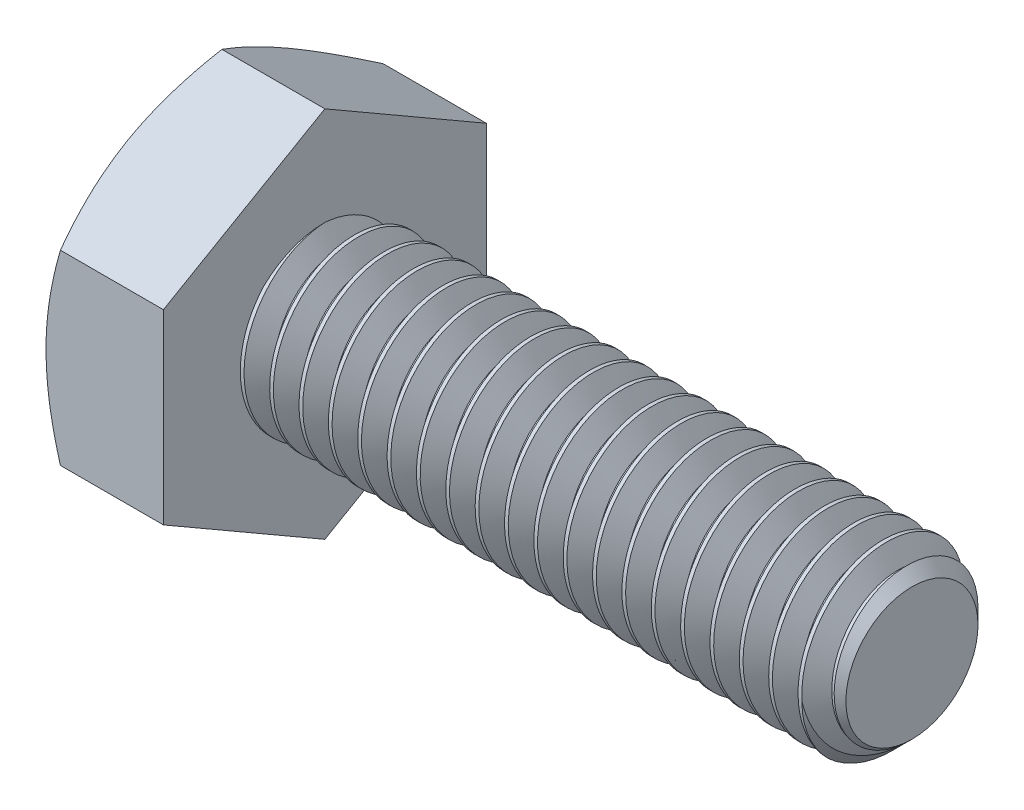
from build123d import *

# Parameters (mm, degrees)
SKETCH2_R           = 1.5
BOSS_EXTRUDE1_DEPTH = 10
CHAMFER1_SIZE       = 0.375
CUT_SWEEP1_PITCH    = 0.5
BOSS_EXTRUDE2_DEPTH = 2
SKETCH6_OUTSIDE_W   = 57.936
SKETCH6_OUTSIDE_H   = 58.786
SKETCH6_OUTSIDE_R   = 2.75
CUT_EXTRUDE1_DEPTH  = 13.714001609
CUT_EXTRUDE1_DRAFT  = -60
SKETCH7_W           = 0.13170865
SKETCH7_H           = 0.131708651
CUT_EXTRUDE2_DEPTH  = 0.25


with BuildPart() as part:
    # Sketch2 → Boss-Extrude1 (new body)
    with BuildSketch(Plane(origin=(6, 0, 0), x_dir=(0, 0, -1), z_dir=(1, 0, 0))):
        Circle(SKETCH2_R)
    extrude(amount=-BOSS_EXTRUDE1_DEPTH)

    # Chamfer1
    chamfer1_edges = [part.edges().sort_by_distance(p)[0] for p in [
        (6, 0, 1.5),
    ]]
    chamfer(chamfer1_edges, length=CHAMFER1_SIZE)

    # Cut-Sweep1: the profile of Sketch5 profile screwed along a right-hand helix of 21 turns, 6 arcs to a turn; built about Z, then put on its axis
    cut_sweep1_z = Axis((0, 0, 0), (0, 0, 1))
    cut_sweep1_corners = [(1.5003, 0, 0.000173205), (1.175240474, 0, -0.1875), (1.175240474, 0, -0.25), (1.5003, 0, -0.437673205)]
    with BuildLine(mode=Mode.PRIVATE) as cut_sweep1_profile:
        Line(cut_sweep1_corners[0], cut_sweep1_corners[1])
        Line(cut_sweep1_corners[1], cut_sweep1_corners[2])
        Line(cut_sweep1_corners[2], cut_sweep1_corners[3])
        Line(cut_sweep1_corners[3], cut_sweep1_corners[0])
    cut_sweep1_cap = Face(cut_sweep1_profile.wire())
    cut_sweep1_turn_angles = [0, 30, 60, 90, 120, 150, 180, 210, 240, 270, 300, 330, 360]
    cut_sweep1_turn_weights = [1, 0.8660254037844387, 1, 0.8660254037844387, 1, 0.8660254037844387, 1, 0.8660254037844387, 1, 0.8660254037844387, 1, 0.8660254037844387, 1]
    cut_sweep1_turn_rails = [Edge.make_bspline([Vector(p[0], p[1], 0).rotate(cut_sweep1_z, cut_sweep1_turn_angles[k]) / cut_sweep1_turn_weights[k] + Vector(0, 0, p[2] + CUT_SWEEP1_PITCH * cut_sweep1_turn_angles[k] / 360) for k in range(13)], [0, 0, 0, 1, 1, 2, 2, 3, 3, 4, 4, 5, 5, 6, 6, 6], 2, cut_sweep1_turn_weights) for p in cut_sweep1_corners]
    cut_sweep1_turn_sides = [Face.make_surface_from_curves(cut_sweep1_turn_rails[p[0]], cut_sweep1_turn_rails[p[1]]) for p in [(0, 1), (1, 2), (2, 3), (3, 0)]]
    cut_sweep1 = Plane(origin=(6, 0, 0), x_dir=(0, 1, 0), z_dir=(-1, 0, 0)) * Solid(Shell([*[p.moved(Location((0, 0, CUT_SWEEP1_PITCH * i))) for i in range(21) for p in cut_sweep1_turn_sides], cut_sweep1_cap, cut_sweep1_cap.rotate(cut_sweep1_z, 7560).moved(Location((0, 0, CUT_SWEEP1_PITCH * 7560 / 360)))]))
    add(cut_sweep1, mode=Mode.SUBTRACT)

    # Sketch3 → Boss-Extrude2 (add)
    with BuildSketch(Plane.ZY.offset(4)):
        Polygon((-2.75, -1.58771324), (0, -3.175426481), (2.75, -1.58771324), (2.75, 1.58771324), (0, 3.175426481), (-2.75, 1.58771324), align=None)
    extrude(amount=BOSS_EXTRUDE2_DEPTH)


with BuildPart() as cut_extrude1_tool:
    # Sketch6 outside → Cut-Extrude1 (with draft: the straight prism first)
    with BuildSketch(Plane.ZY.offset(6)):
        Rectangle(SKETCH6_OUTSIDE_W, SKETCH6_OUTSIDE_H)
        Circle(SKETCH6_OUTSIDE_R, mode=Mode.SUBTRACT)
    extrude(amount=-CUT_EXTRUDE1_DEPTH)
    # Cut-Extrude1: the draft: its side faces are tilted about the plane it starts from
    cut_extrude1_sides = [cut_extrude1_tool.faces().sort_by_distance(p)[0] for p in [
        (0.857000805, -29.393, 0),
        (0.857000805, 0, 28.968),
        (0.857000805, 29.393, 0),
        (0.857000805, 0, -28.968),
        (0.857000805, 0, -2.75),
    ]]
    draft(cut_extrude1_sides, Plane.ZY.offset(6), CUT_EXTRUDE1_DRAFT)


with BuildPart() as part_1:
    add(part.part)

    # Cut-Extrude1: cut by cut_extrude1_tool
    add(cut_extrude1_tool.part, mode=Mode.SUBTRACT)

    # Sketch7 → Cut-Extrude2 (cut)
    # profile 1 of 3: a face of its own
    with BuildSketch(Plane.ZY.offset(6)):
        with BuildLine():
            add(Edge.make_bspline(
                [(-0.726867115, 1.93846607), (-0.73936394, 1.943354899), (-0.763324498, 1.952728405), (-0.795641113, 1.971487429), (-0.822991963, 1.993067216), (-0.845041214, 2.017988147), (-0.861846751, 2.04573504), (-0.873947403, 2.075954123), (-0.881034967, 2.108813748), (-0.881967772, 2.131535333), (-0.882447958, 2.143231863)],
                knots=[0, 0, 0, 0, 1.16287356, 2.229614231, 3.228817875, 4.173350329, 5.100165549, 6.029633206, 6.985702163, 8, 8, 8, 8], degree=3))
            add(Edge.make_bspline(
                [(-0.882447958, 2.143231863), (-0.882221957, 2.152231827), (-0.88177831, 2.169899038), (-0.877945096, 2.195822679), (-0.871805651, 2.220664012), (-0.863092343, 2.244352926), (-0.852175996, 2.267084402), (-0.838401407, 2.28844199), (-0.822568373, 2.309029297), (-0.804020725, 2.328014123), (-0.783581538, 2.345402385), (-0.761442709, 2.360876232), (-0.737434831, 2.373530076), (-0.711958184, 2.384109756), (-0.684886798, 2.392392527), (-0.656125314, 2.398033555), (-0.625775122, 2.401621668), (-0.604978449, 2.402088541), (-0.594335285, 2.402327474)],
                knots=[0, 0, 0, 0, 0.994101948, 1.951453197, 2.889123786, 3.817215529, 4.736003873, 5.669743943, 6.620499649, 7.601567446, 8.596478358, 9.582687259, 10.579761808, 11.589151689, 12.62747492, 13.702346593, 14.8241243, 16, 16, 16, 16], degree=3))
            add(Edge.make_bspline(
                [(-0.594335285, 2.402327474), (-0.583624302, 2.402086115), (-0.562760515, 2.401615976), (-0.532249079, 2.398076073), (-0.503306091, 2.392142977), (-0.475948592, 2.383725406), (-0.450133452, 2.372963035), (-0.426030302, 2.359734669), (-0.403391015, 2.344258484), (-0.382794243, 2.326349923), (-0.364053636, 2.306907049), (-0.34781667, 2.286077151), (-0.333890741, 2.264346279), (-0.322383053, 2.241582413), (-0.313869622, 2.217526335), (-0.307380476, 2.192631271), (-0.303616471, 2.16660142), (-0.30316161, 2.148937457), (-0.302929896, 2.139939147)],
                knots=[0, 0, 0, 0, 1.171211919, 2.281388661, 3.353996503, 4.398126828, 5.406889753, 6.407389155, 7.400009931, 8.40008733, 9.387021643, 10.349004252, 11.283445052, 12.206096336, 13.131640667, 14.068727932, 15.016178647, 16, 16, 16, 16], degree=3))
            add(Edge.make_bspline(
                [(-0.302929896, 2.139939147), (-0.303306308, 2.128645746), (-0.30404438, 2.106501511), (-0.311565668, 2.074580412), (-0.323288238, 2.044780466), (-0.340230889, 2.017669609), (-0.361688126, 1.992967845), (-0.388314847, 1.971494332), (-0.419706675, 1.952764625), (-0.443062266, 1.943360555), (-0.455218023, 1.93846607)],
                knots=[0, 0, 0, 0, 0.998680737, 1.958225066, 2.887911823, 3.823713378, 4.77537694, 5.772726054, 6.840782926, 8, 8, 8, 8], degree=3))
            add(Edge.make_bspline(
                [(-0.455218023, 1.93846607), (-0.44754853, 1.935862641), (-0.43251965, 1.930761048), (-0.411273298, 1.92084198), (-0.391270497, 1.91014687), (-0.372398447, 1.898569408), (-0.355353764, 1.885248603), (-0.339567786, 1.870972062), (-0.325106884, 1.855538598), (-0.312168579, 1.838816949), (-0.300617309, 1.821158074), (-0.290728504, 1.802518919), (-0.282330132, 1.783164789), (-0.275152595, 1.763005935), (-0.269909971, 1.741900359), (-0.266241777, 1.719945054), (-0.263914412, 1.697255732), (-0.263584727, 1.68184564), (-0.263417301, 1.674019796)],
                knots=[0, 0, 0, 0, 1.104208047, 2.163768705, 3.193778962, 4.198696312, 5.179575955, 6.14024585, 7.100368562, 8.060719304, 9.021161243, 9.975749006, 10.935506756, 11.897452199, 12.89163552, 13.897859372, 14.932451246, 16, 16, 16, 16], degree=3))
            add(Edge.make_bspline(
                [(-0.263417301, 1.674019796), (-0.263679044, 1.663233663), (-0.264194697, 1.641984159), (-0.268725389, 1.610792381), (-0.275580527, 1.580828422), (-0.28557611, 1.55221886), (-0.298342952, 1.524943473), (-0.31413569, 1.499041865), (-0.332799155, 1.474540683), (-0.353782807, 1.451363768), (-0.377242518, 1.43041284), (-0.40262158, 1.41195045), (-0.430015217, 1.396485845), (-0.459091052, 1.383681207), (-0.489988311, 1.373757661), (-0.522667275, 1.366809074), (-0.557117072, 1.362671496), (-0.580672776, 1.362113684), (-0.592688927, 1.361829135)],
                knots=[0, 0, 0, 0, 1.017598406, 2.004746413, 2.969099523, 3.915171376, 4.859468899, 5.806714415, 6.772805022, 7.762836953, 8.753334612, 9.736396794, 10.719437652, 11.716790048, 12.730404696, 13.776887535, 14.865953843, 16, 16, 16, 16], degree=3))
            add(Edge.make_bspline(
                [(-0.592688927, 1.361829135), (-0.604703877, 1.362119816), (-0.628257224, 1.36268965), (-0.662738496, 1.366742641), (-0.695370706, 1.374006226), (-0.72622779, 1.38393986), (-0.755477138, 1.396397811), (-0.782686802, 1.412210873), (-0.808231639, 1.430649872), (-0.831707661, 1.451730387), (-0.852865614, 1.47490483), (-0.871283054, 1.499767857), (-0.886982039, 1.525936834), (-0.899901963, 1.553559282), (-0.909749891, 1.582635452), (-0.916661284, 1.613056183), (-0.921200176, 1.644798228), (-0.921703523, 1.666457929), (-0.921960554, 1.677518307)],
                knots=[0, 0, 0, 0, 1.127066097, 2.209429196, 3.250843736, 4.258219581, 5.246860502, 6.227045772, 7.204057202, 8.19754525, 9.181483529, 10.142920909, 11.095356922, 12.039670968, 12.998174893, 13.969127444, 14.962948905, 16, 16, 16, 16], degree=3))
            add(Edge.make_bspline(
                [(-0.921960554, 1.677518307), (-0.921781898, 1.685753581), (-0.921431345, 1.701912613), (-0.919289935, 1.725613517), (-0.915022145, 1.748202969), (-0.909524961, 1.76981409), (-0.902545257, 1.790500944), (-0.893934463, 1.810101077), (-0.883487352, 1.828567119), (-0.871618749, 1.846019226), (-0.858178885, 1.862334879), (-0.84338559, 1.877371198), (-0.827185128, 1.890957154), (-0.809941552, 1.903489554), (-0.790932073, 1.91408189), (-0.770863647, 1.923802332), (-0.749391246, 1.932092067), (-0.734450352, 1.936320124), (-0.726867115, 1.93846607)],
                knots=[0, 0, 0, 0, 1.117345089, 2.192424383, 3.22371675, 4.232639188, 5.215561493, 6.182180952, 7.132172269, 8.089790513, 9.041830748, 9.996006267, 10.94686322, 11.907506267, 12.882866327, 13.894317773, 14.931262935, 16, 16, 16, 16], degree=3))
        make_face()
        with BuildLine():
            add(Edge.make_bspline(
                [(-0.750739308, 2.142614479), (-0.750348398, 2.132129547), (-0.749592987, 2.111868007), (-0.74137781, 2.083087974), (-0.728531658, 2.057235433), (-0.713471799, 2.038487769), (-0.699033176, 2.025714016), (-0.686982157, 2.017185435), (-0.673812723, 2.009944842), (-0.659429469, 2.004316996), (-0.644180757, 1.999331075), (-0.627540681, 1.996544308), (-0.609900356, 1.994278832), (-0.597705187, 1.994114758), (-0.591454159, 1.994030657)],
                knots=[0, 0, 0, 0, 1.528727296, 2.954179336, 4.335216052, 5.725683216, 6.435919001, 7.148062981, 7.879427438, 8.626027458, 9.402978632, 10.2190538, 11.08711833, 12, 12, 12, 12], degree=3))
            add(Edge.make_bspline(
                [(-0.591454159, 1.994030657), (-0.585341116, 1.994117866), (-0.573421016, 1.994287919), (-0.556177993, 1.996507208), (-0.539883396, 1.999471279), (-0.524778012, 2.003962872), (-0.51068745, 2.009803253), (-0.497840886, 2.017003001), (-0.485853891, 2.025277577), (-0.471839421, 2.038148921), (-0.456800344, 2.056239968), (-0.443911141, 2.080937639), (-0.435879138, 2.107958357), (-0.435059337, 2.126779863), (-0.434638547, 2.136440636)],
                knots=[0, 0, 0, 0, 0.922112375, 1.798068639, 2.620552757, 3.419964248, 4.17189205, 4.918165909, 5.639229138, 6.36503528, 7.785020832, 9.165298717, 10.544993853, 12, 12, 12, 12], degree=3))
            add(Edge.make_bspline(
                [(-0.434638547, 2.136440636), (-0.43514554, 2.146439122), (-0.436137595, 2.166003571), (-0.444149978, 2.19408922), (-0.457639527, 2.219526429), (-0.473049466, 2.238102863), (-0.487311851, 2.251560396), (-0.499514048, 2.260127017), (-0.512631456, 2.267417969), (-0.526713999, 2.273372013), (-0.541782041, 2.278174012), (-0.5578764, 2.281324354), (-0.574929448, 2.2835338), (-0.586644539, 2.283702598), (-0.592688927, 2.283789689)],
                knots=[0, 0, 0, 0, 1.480633456, 2.897216237, 4.289382554, 5.720567045, 6.454675042, 7.191244726, 7.924224627, 8.676083236, 9.454506446, 10.26432127, 11.104478565, 12, 12, 12, 12], degree=3))
            add(Edge.make_bspline(
                [(-0.592688927, 2.283789689), (-0.598733988, 2.283705414), (-0.610518539, 2.283541126), (-0.627682784, 2.281265379), (-0.643929669, 2.278407087), (-0.659109306, 2.273820057), (-0.673158599, 2.267825875), (-0.686224291, 2.260530828), (-0.698403368, 2.252183028), (-0.712765956, 2.239325588), (-0.727808401, 2.221234132), (-0.741060372, 2.196930912), (-0.749250519, 2.1704322), (-0.750236898, 2.152001903), (-0.750739308, 2.142614479)],
                knots=[0, 0, 0, 0, 0.914830409, 1.783417199, 2.618873138, 3.411020283, 4.179090249, 4.927874451, 5.674348476, 6.410336976, 7.841713217, 9.213201474, 10.580551314, 12, 12, 12, 12], degree=3))
        make_face(mode=Mode.SUBTRACT)
        with BuildLine():
            add(Edge.make_bspline(
                [(-0.790251903, 1.679987844), (-0.790024149, 1.671536696), (-0.789568041, 1.654612137), (-0.785566993, 1.629475581), (-0.778778044, 1.604807114), (-0.770076823, 1.580583434), (-0.757803211, 1.557782252), (-0.74152702, 1.53743052), (-0.721103449, 1.52032001), (-0.697778614, 1.505864402), (-0.672325222, 1.494486595), (-0.645802044, 1.4865445), (-0.618893628, 1.481296759), (-0.600738883, 1.480676902), (-0.591659953, 1.48036692)],
                knots=[0, 0, 0, 0, 0.957879255, 1.91828174, 2.876792425, 3.856375228, 4.831004356, 5.799187063, 6.79220414, 7.836856316, 8.902268238, 9.943090861, 10.971368942, 12, 12, 12, 12], degree=3))
            add(Edge.make_bspline(
                [(-0.591659953, 1.48036692), (-0.584173397, 1.480493737), (-0.569629151, 1.480740106), (-0.548428195, 1.483555399), (-0.528452101, 1.487827119), (-0.50960935, 1.493684348), (-0.492177286, 1.501697425), (-0.475872034, 1.511062971), (-0.460860378, 1.52238195), (-0.447146566, 1.535299763), (-0.434870273, 1.549589284), (-0.424354076, 1.565004556), (-0.415180673, 1.581112061), (-0.407691009, 1.598259423), (-0.402274775, 1.616482003), (-0.398095385, 1.635451026), (-0.395574083, 1.655362146), (-0.395277494, 1.668936264), (-0.395125952, 1.675871949)],
                knots=[0, 0, 0, 0, 1.149387474, 2.232932207, 3.278773642, 4.285224938, 5.256757121, 6.220082341, 7.168479488, 8.137608443, 9.109140627, 10.056190326, 10.999892409, 11.953252726, 12.923240661, 13.915357002, 14.934853301, 16, 16, 16, 16], degree=3))
            add(Edge.make_bspline(
                [(-0.395125952, 1.675871949), (-0.39528232, 1.682943773), (-0.395588464, 1.696789278), (-0.398045692, 1.717137406), (-0.402459435, 1.73644016), (-0.408135527, 1.754989149), (-0.415828255, 1.772461673), (-0.425062297, 1.789108268), (-0.436370248, 1.804490166), (-0.448770318, 1.819129585), (-0.462803045, 1.832381644), (-0.478299567, 1.843809394), (-0.494768766, 1.853902033), (-0.512708848, 1.86164394), (-0.53172457, 1.867845383), (-0.551906272, 1.872351446), (-0.573336241, 1.875105883), (-0.588015675, 1.875361385), (-0.595570054, 1.875492872)],
                knots=[0, 0, 0, 0, 1.065858887, 2.086781919, 3.082735321, 4.047496077, 5.006086125, 5.955204095, 6.910833714, 7.878747924, 8.844339535, 9.812198509, 10.776903849, 11.749116737, 12.749729282, 13.788304076, 14.861809717, 16, 16, 16, 16], degree=3))
            add(Edge.make_bspline(
                [(-0.595570054, 1.875492872), (-0.602919289, 1.875360076), (-0.617326077, 1.875099755), (-0.638255158, 1.872329716), (-0.658068568, 1.868075855), (-0.676591987, 1.861849762), (-0.694057016, 1.854069627), (-0.710144225, 1.844286664), (-0.725140608, 1.832931436), (-0.73858808, 1.819733142), (-0.750721185, 1.805396207), (-0.761211553, 1.790027057), (-0.77047873, 1.773982209), (-0.777511395, 1.756735175), (-0.783463917, 1.738843519), (-0.787185184, 1.719959983), (-0.78983054, 1.700299118), (-0.790109396, 1.686857225), (-0.790251903, 1.679987844)],
                knots=[0, 0, 0, 0, 1.135239447, 2.225422834, 3.256957183, 4.262780498, 5.240265059, 6.205773948, 7.16638056, 8.141101257, 9.111719309, 10.064571387, 11.014055337, 11.969087385, 12.938082716, 13.92369833, 14.938921288, 16, 16, 16, 16], degree=3))
        make_face(mode=Mode.SUBTRACT)
    # profile 2 of 3: a face of its own
    with BuildSketch(Plane.ZY.offset(6)):
        with Locations((0, 1.440854326)):
            Rectangle(SKETCH7_W, SKETCH7_H)
    # profile 3 of 3: a face of its own
    with BuildSketch(Plane.ZY.offset(6)):
        with BuildLine():
            add(Edge.make_bspline(
                [(0.45851074, 1.93846607), (0.446013914, 1.943354899), (0.422053356, 1.952728405), (0.389736741, 1.971487429), (0.362385892, 1.993067216), (0.340336641, 2.017988147), (0.323531103, 2.04573504), (0.311430451, 2.075954123), (0.304342888, 2.108813748), (0.303410082, 2.131535333), (0.302929896, 2.143231863)],
                knots=[0, 0, 0, 0, 1.16287356, 2.229614231, 3.228817875, 4.173350329, 5.100165549, 6.029633206, 6.985702163, 8, 8, 8, 8], degree=3))
            add(Edge.make_bspline(
                [(0.302929896, 2.143231863), (0.303155897, 2.152231827), (0.303599545, 2.169899038), (0.307432759, 2.195822679), (0.313572203, 2.220664012), (0.322285511, 2.244352926), (0.333201858, 2.267084402), (0.346976447, 2.28844199), (0.362809482, 2.309029297), (0.381357129, 2.328014123), (0.401796316, 2.345402385), (0.423935145, 2.360876232), (0.447943023, 2.373530076), (0.47341967, 2.384109756), (0.500491056, 2.392392527), (0.52925254, 2.398033555), (0.559602733, 2.401621668), (0.580399405, 2.402088541), (0.591042569, 2.402327474)],
                knots=[0, 0, 0, 0, 0.994101948, 1.951453197, 2.889123786, 3.817215529, 4.736003873, 5.669743943, 6.620499649, 7.601567446, 8.596478358, 9.582687259, 10.579761808, 11.589151689, 12.62747492, 13.702346593, 14.8241243, 16, 16, 16, 16], degree=3))
            add(Edge.make_bspline(
                [(0.591042569, 2.402327474), (0.601753552, 2.402086115), (0.622617339, 2.401615976), (0.653128776, 2.398076073), (0.682071764, 2.392142977), (0.709429263, 2.383725406), (0.735244403, 2.372963035), (0.759347552, 2.359734669), (0.781986839, 2.344258484), (0.802583611, 2.326349923), (0.821324219, 2.306907049), (0.837561185, 2.286077151), (0.851487114, 2.264346279), (0.862994802, 2.241582413), (0.871508233, 2.217526335), (0.877997379, 2.192631271), (0.881761384, 2.16660142), (0.882216245, 2.148937457), (0.882447958, 2.139939147)],
                knots=[0, 0, 0, 0, 1.171211919, 2.281388661, 3.353996503, 4.398126828, 5.406889753, 6.407389155, 7.400009931, 8.40008733, 9.387021643, 10.349004252, 11.283445052, 12.206096336, 13.131640667, 14.068727932, 15.016178647, 16, 16, 16, 16], degree=3))
            add(Edge.make_bspline(
                [(0.882447958, 2.139939147), (0.882071547, 2.128645746), (0.881333474, 2.106501511), (0.873812187, 2.074580412), (0.862089617, 2.044780466), (0.845146966, 2.017669609), (0.823689728, 1.992967845), (0.797063008, 1.971494332), (0.76567118, 1.952764625), (0.742315588, 1.943360555), (0.730159831, 1.93846607)],
                knots=[0, 0, 0, 0, 0.998680737, 1.958225066, 2.887911823, 3.823713378, 4.77537694, 5.772726054, 6.840782926, 8, 8, 8, 8], degree=3))
            add(Edge.make_bspline(
                [(0.730159831, 1.93846607), (0.737829325, 1.935862641), (0.752858204, 1.930761048), (0.774104556, 1.92084198), (0.794107358, 1.91014687), (0.812979407, 1.898569408), (0.830024091, 1.885248603), (0.845810069, 1.870972062), (0.860270971, 1.855538598), (0.873209275, 1.838816949), (0.884760546, 1.821158074), (0.89464935, 1.802518919), (0.903047722, 1.783164789), (0.91022526, 1.763005935), (0.915467884, 1.741900359), (0.919136078, 1.719945054), (0.921463443, 1.697255732), (0.921793127, 1.68184564), (0.921960554, 1.674019796)],
                knots=[0, 0, 0, 0, 1.104208047, 2.163768705, 3.193778962, 4.198696312, 5.179575955, 6.14024585, 7.100368562, 8.060719304, 9.021161243, 9.975749006, 10.935506756, 11.897452199, 12.89163552, 13.897859372, 14.932451246, 16, 16, 16, 16], degree=3))
            add(Edge.make_bspline(
                [(0.921960554, 1.674019796), (0.921698811, 1.663233663), (0.921183157, 1.641984159), (0.916652465, 1.610792381), (0.909797327, 1.580828422), (0.899801745, 1.55221886), (0.887034903, 1.524943473), (0.871242165, 1.499041865), (0.852578699, 1.474540683), (0.831595047, 1.451363768), (0.808135336, 1.43041284), (0.782756275, 1.41195045), (0.755362637, 1.396485845), (0.726286802, 1.383681207), (0.695389544, 1.373757661), (0.662710579, 1.366809074), (0.628260782, 1.362671496), (0.604705079, 1.362113684), (0.592688927, 1.361829135)],
                knots=[0, 0, 0, 0, 1.017598406, 2.004746413, 2.969099523, 3.915171376, 4.859468899, 5.806714415, 6.772805022, 7.762836953, 8.753334612, 9.736396794, 10.719437652, 11.716790048, 12.730404696, 13.776887535, 14.865953843, 16, 16, 16, 16], degree=3))
            add(Edge.make_bspline(
                [(0.592688927, 1.361829135), (0.580673978, 1.362119816), (0.55712063, 1.36268965), (0.522639358, 1.366742641), (0.490007149, 1.374006226), (0.459150065, 1.38393986), (0.429900716, 1.396397811), (0.402691053, 1.412210873), (0.377146216, 1.430649872), (0.353670193, 1.451730387), (0.33251224, 1.47490483), (0.314094801, 1.499767857), (0.298395816, 1.525936834), (0.285475892, 1.553559282), (0.275627964, 1.582635452), (0.268716571, 1.613056183), (0.264177678, 1.644798228), (0.263674331, 1.666457929), (0.263417301, 1.677518307)],
                knots=[0, 0, 0, 0, 1.127066097, 2.209429196, 3.250843736, 4.258219581, 5.246860502, 6.227045772, 7.204057202, 8.19754525, 9.181483529, 10.142920909, 11.095356922, 12.039670968, 12.998174893, 13.969127444, 14.962948905, 16, 16, 16, 16], degree=3))
            add(Edge.make_bspline(
                [(0.263417301, 1.677518307), (0.263595957, 1.685753581), (0.26394651, 1.701912613), (0.26608792, 1.725613517), (0.270355709, 1.748202969), (0.275852894, 1.76981409), (0.282832598, 1.790500944), (0.291443391, 1.810101077), (0.301890502, 1.828567119), (0.313759106, 1.846019226), (0.327198969, 1.862334879), (0.341992264, 1.877371198), (0.358192726, 1.890957154), (0.375436302, 1.903489554), (0.394445782, 1.91408189), (0.414514207, 1.923802332), (0.435986609, 1.932092067), (0.450927503, 1.936320124), (0.45851074, 1.93846607)],
                knots=[0, 0, 0, 0, 1.117345089, 2.192424383, 3.22371675, 4.232639188, 5.215561493, 6.182180952, 7.132172269, 8.089790513, 9.041830748, 9.996006267, 10.94686322, 11.907506267, 12.882866327, 13.894317773, 14.931262935, 16, 16, 16, 16], degree=3))
        make_face()
        with BuildLine():
            add(Edge.make_bspline(
                [(0.434638547, 2.142614479), (0.435029456, 2.132129547), (0.435784868, 2.111868007), (0.444000044, 2.083087974), (0.456846197, 2.057235433), (0.471906056, 2.038487769), (0.486344679, 2.025714016), (0.498395698, 2.017185435), (0.511565131, 2.009944842), (0.525948385, 2.004316996), (0.541197097, 1.999331075), (0.557837174, 1.996544308), (0.575477499, 1.994278832), (0.587672667, 1.994114758), (0.593923696, 1.994030657)],
                knots=[0, 0, 0, 0, 1.528727296, 2.954179336, 4.335216052, 5.725683216, 6.435919001, 7.148062981, 7.879427438, 8.626027458, 9.402978632, 10.2190538, 11.08711833, 12, 12, 12, 12], degree=3))
            add(Edge.make_bspline(
                [(0.593923696, 1.994030657), (0.600036739, 1.994117866), (0.611956838, 1.994287919), (0.629199861, 1.996507208), (0.645494458, 1.999471279), (0.660599842, 2.003962872), (0.674690405, 2.009803253), (0.687536968, 2.017003001), (0.699523964, 2.025277577), (0.713538434, 2.038148921), (0.728577511, 2.056239968), (0.741466713, 2.080937639), (0.749498716, 2.107958357), (0.750318517, 2.126779863), (0.750739308, 2.136440636)],
                knots=[0, 0, 0, 0, 0.922112375, 1.798068639, 2.620552757, 3.419964248, 4.17189205, 4.918165909, 5.639229138, 6.36503528, 7.785020832, 9.165298717, 10.544993853, 12, 12, 12, 12], degree=3))
            add(Edge.make_bspline(
                [(0.750739308, 2.136440636), (0.750232314, 2.146439122), (0.749240259, 2.166003571), (0.741227876, 2.19408922), (0.727738328, 2.219526429), (0.712328389, 2.238102863), (0.698066004, 2.251560396), (0.685863806, 2.260127017), (0.672746399, 2.267417969), (0.658663856, 2.273372013), (0.643595813, 2.278174012), (0.627501454, 2.281324354), (0.610448407, 2.2835338), (0.598733315, 2.283702598), (0.592688927, 2.283789689)],
                knots=[0, 0, 0, 0, 1.480633456, 2.897216237, 4.289382554, 5.720567045, 6.454675042, 7.191244726, 7.924224627, 8.676083236, 9.454506446, 10.26432127, 11.104478565, 12, 12, 12, 12], degree=3))
            add(Edge.make_bspline(
                [(0.592688927, 2.283789689), (0.586643867, 2.283705414), (0.574859316, 2.283541126), (0.557695071, 2.281265379), (0.541448185, 2.278407087), (0.526268548, 2.273820057), (0.512219256, 2.267825875), (0.499153564, 2.260530828), (0.486974486, 2.252183028), (0.472611898, 2.239325588), (0.457569453, 2.221234132), (0.444317483, 2.196930912), (0.436127336, 2.1704322), (0.435140957, 2.152001903), (0.434638547, 2.142614479)],
                knots=[0, 0, 0, 0, 0.914830409, 1.783417199, 2.618873138, 3.411020283, 4.179090249, 4.927874451, 5.674348476, 6.410336976, 7.841713217, 9.213201474, 10.580551314, 12, 12, 12, 12], degree=3))
        make_face(mode=Mode.SUBTRACT)
        with BuildLine():
            add(Edge.make_bspline(
                [(0.395125952, 1.679987844), (0.395353705, 1.671536696), (0.395809813, 1.654612137), (0.399810861, 1.629475581), (0.406599811, 1.604807114), (0.415301031, 1.580583434), (0.427574644, 1.557782252), (0.443850835, 1.53743052), (0.464274406, 1.52032001), (0.487599241, 1.505864402), (0.513052632, 1.494486595), (0.539575811, 1.4865445), (0.566484227, 1.481296759), (0.584638971, 1.480676902), (0.593717901, 1.48036692)],
                knots=[0, 0, 0, 0, 0.957879255, 1.91828174, 2.876792425, 3.856375228, 4.831004356, 5.799187063, 6.79220414, 7.836856316, 8.902268238, 9.943090861, 10.971368942, 12, 12, 12, 12], degree=3))
            add(Edge.make_bspline(
                [(0.593717901, 1.48036692), (0.601204458, 1.480493737), (0.615748703, 1.480740106), (0.63694966, 1.483555399), (0.656925754, 1.487827119), (0.675768505, 1.493684348), (0.693200569, 1.501697425), (0.70950582, 1.511062971), (0.724517476, 1.52238195), (0.738231288, 1.535299763), (0.750507581, 1.549589284), (0.761023778, 1.565004556), (0.770197181, 1.581112061), (0.777686845, 1.598259423), (0.78310308, 1.616482003), (0.78728247, 1.635451026), (0.789803772, 1.655362146), (0.790100361, 1.668936264), (0.790251903, 1.675871949)],
                knots=[0, 0, 0, 0, 1.149387474, 2.232932207, 3.278773642, 4.285224938, 5.256757121, 6.220082341, 7.168479488, 8.137608443, 9.109140627, 10.056190326, 10.999892409, 11.953252726, 12.923240661, 13.915357002, 14.934853301, 16, 16, 16, 16], degree=3))
            add(Edge.make_bspline(
                [(0.790251903, 1.675871949), (0.790095535, 1.682943773), (0.78978939, 1.696789278), (0.787332163, 1.717137406), (0.78291842, 1.73644016), (0.777242328, 1.754989149), (0.7695496, 1.772461673), (0.760315557, 1.789108268), (0.749007607, 1.804490166), (0.736607537, 1.819129585), (0.72257481, 1.832381644), (0.707078287, 1.843809394), (0.690609089, 1.853902033), (0.672669007, 1.86164394), (0.653653285, 1.867845383), (0.633471582, 1.872351446), (0.612041613, 1.875105883), (0.597362179, 1.875361385), (0.589807801, 1.875492872)],
                knots=[0, 0, 0, 0, 1.065858887, 2.086781919, 3.082735321, 4.047496077, 5.006086125, 5.955204095, 6.910833714, 7.878747924, 8.844339535, 9.812198509, 10.776903849, 11.749116737, 12.749729282, 13.788304076, 14.861809717, 16, 16, 16, 16], degree=3))
            add(Edge.make_bspline(
                [(0.589807801, 1.875492872), (0.582458566, 1.875360076), (0.568051778, 1.875099755), (0.547122696, 1.872329716), (0.527309286, 1.868075855), (0.508785867, 1.861849762), (0.491320838, 1.854069627), (0.47523363, 1.844286664), (0.460237247, 1.832931436), (0.446789775, 1.819733142), (0.43465667, 1.805396207), (0.424166302, 1.790027057), (0.414899124, 1.773982209), (0.407866459, 1.756735175), (0.401913938, 1.738843519), (0.398192671, 1.719959983), (0.395547314, 1.700299118), (0.395268459, 1.686857225), (0.395125952, 1.679987844)],
                knots=[0, 0, 0, 0, 1.135239447, 2.225422834, 3.256957183, 4.262780498, 5.240265059, 6.205773948, 7.16638056, 8.141101257, 9.111719309, 10.064571387, 11.014055337, 11.969087385, 12.938082716, 13.92369833, 14.938921288, 16, 16, 16, 16], degree=3))
        make_face(mode=Mode.SUBTRACT)
    extrude(amount=-CUT_EXTRUDE2_DEPTH, mode=Mode.SUBTRACT)


solid = part_1.part
